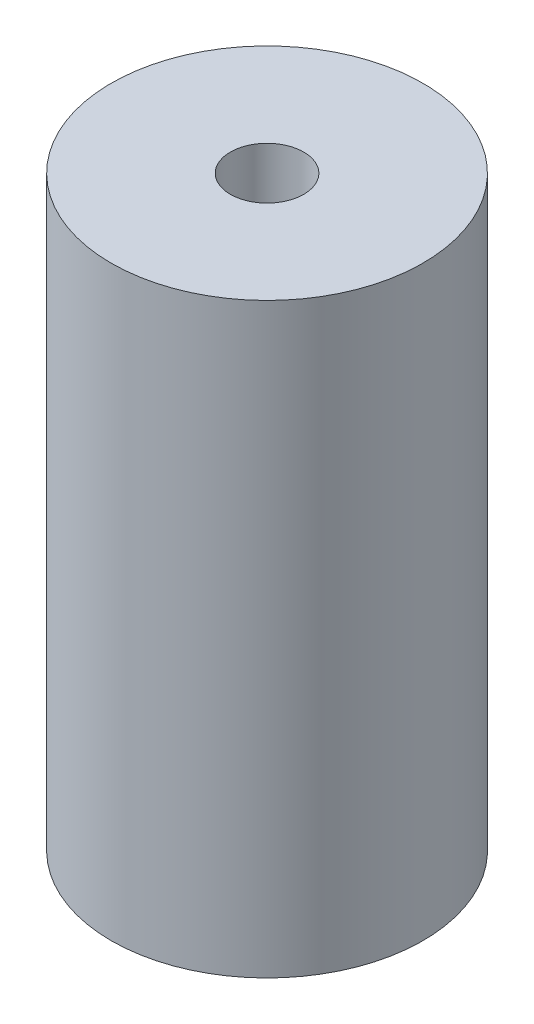
from build123d import *

# Parameters (mm, degrees)
BOSS_EXTRUDE1_DEPTH      = 95.25
BOSS_EXTRUDE1_DEPTH_BACK = 6.35
SKETCH1_R                = 26.9875
SKETCH1_R_2              = 6.35


with BuildPart() as part:
    # Sketch1 → Boss-Extrude1 (new, two sides: drawn at the far end of the back side and taken through both)
    with BuildSketch(Plane(origin=(0, 0, 0), x_dir=(1, 0, 0), z_dir=(0, 1, 0)).offset(-BOSS_EXTRUDE1_DEPTH_BACK)):
        Circle(SKETCH1_R)
        Circle(SKETCH1_R_2, mode=Mode.SUBTRACT)
    extrude(amount=BOSS_EXTRUDE1_DEPTH + BOSS_EXTRUDE1_DEPTH_BACK)


solid = part.part
